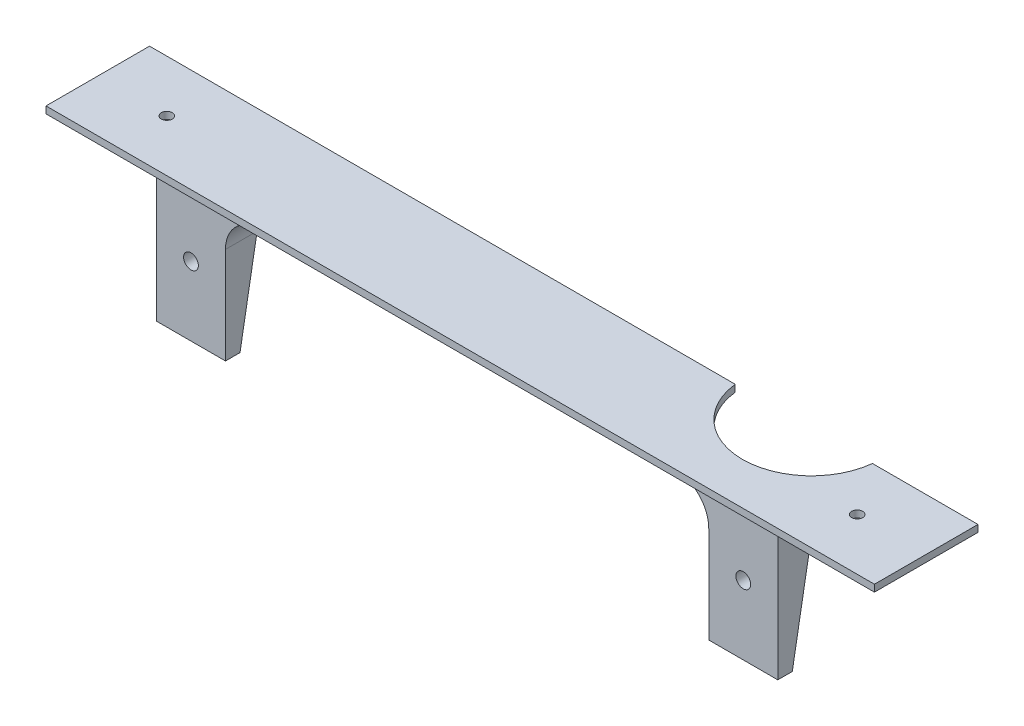
from build123d import *

# Parameters (mm, degrees)
ESQUISSE1_W             = 240
ESQUISSE1_H             = 2
BOSS_EXTRU_1_DEPTH      = 30
ESQUISSE1_3_W           = 180
ESQUISSE1_3_H           = 38
BOSS_EXTRU_2_DEPTH      = 1.2
ESQUISSE2_R             = 1.6
ENL_V_MAT_EXTRU_1_DEPTH = 131
ESQUISSE3_W             = 180
ESQUISSE3_H             = 38
BOSS_EXTRU_3_DEPTH      = 10
ESQUISSE4_W             = 180
ESQUISSE4_H             = 38
ENL_V_MAT_EXTRU_2_DEPTH = 2
ESQUISSE5_W             = 140
ESQUISSE5_H             = 38
ENL_V_MAT_EXTRU_3_DEPTH = 130.247823966
CONG_1_R                = 10
CHANFREIN1_START        = -21.049758641
CHANFREIN1_DEPTH        = 8.142458431
ESQUISSE6_R             = 2.15
ENL_V_MAT_EXTRU_4_DEPTH = 130.247823996
ESQUISSE9_R             = 20
ENL_V_MAT_EXTRU_6_DEPTH = 10


with BuildPart() as part:
    # Esquisse1 → Boss.-Extru.1 (new body)
    with BuildSketch(Plane.XY):
        Rectangle(ESQUISSE1_W, ESQUISSE1_H)
    extrude(amount=-BOSS_EXTRU_1_DEPTH)

    # Esquisse1<3> → Boss.-Extru.2 (add)
    with BuildSketch(Plane.XY):
        with Locations((0, -20)):
            Rectangle(ESQUISSE1_3_W, ESQUISSE1_3_H)
    extrude(amount=-BOSS_EXTRU_2_DEPTH)

    # Esquisse2 → Enlèv. mat.-Extru.1 (cut, through all)
    with BuildSketch(Plane(origin=(0, 1, 0), x_dir=(1, 0, 0), z_dir=(0, 1, 0))):
        with Locations(Location((-100, 15, 0), (0, 0, 270))):
            Circle(ESQUISSE2_R)
        with Locations(Location((100, 15, 0), (0, 0, 270))):
            Circle(ESQUISSE2_R)
    extrude(amount=-ENL_V_MAT_EXTRU_1_DEPTH, mode=Mode.SUBTRACT)

    # Esquisse3 → Boss.-Extru.3 (add)
    with BuildSketch(Plane(origin=(0, 0, -1.2), x_dir=(-1, 0, 0), z_dir=(0, 0, -1))):
        with Locations((0, -20)):
            Rectangle(ESQUISSE3_W, ESQUISSE3_H)
    extrude(amount=BOSS_EXTRU_3_DEPTH)

    # Esquisse4 → Enlèv. mat.-Extru.2 (cut)
    with BuildSketch(Plane.XY):
        with Locations((0, -20)):
            Rectangle(ESQUISSE4_W, ESQUISSE4_H)
    extrude(amount=-ENL_V_MAT_EXTRU_2_DEPTH, mode=Mode.SUBTRACT)

    # Esquisse5 → Enlèv. mat.-Extru.3 (cut, through all)
    with BuildSketch(Plane.XY.offset(-2)):
        with Locations((0, -20)):
            Rectangle(ESQUISSE5_W, ESQUISSE5_H)
    extrude(amount=-ENL_V_MAT_EXTRU_3_DEPTH, mode=Mode.SUBTRACT)

    # Congé1
    cong_1_edges = [part.edges().sort_by_distance(p)[0] for p in [
        (-80, -1, -11.2),
        (80, -1, -11.2),
        (70, -1, -6.6),
        (-70, -1, -6.6),
    ]]
    fillet(cong_1_edges, radius=CONG_1_R)

    # Chanfrein1: read off the stored shape, not the designer's step
    # Chanfrein1 outline → Chanfrein1 (cut)
    with BuildSketch(Plane(origin=(0, 0, 0), x_dir=(1, 0, 0), z_dir=(0, 0.17430886736371906, 0.9846910270528403)).offset(CHANFREIN1_START)):
        with BuildLine():
            Line((-70, -37.321496906), (-70, -8.886181431))
            add(Edge.make_bspline(
                [(-69.997176769, -8.644881308), (-70, -8.765514336), (-70, -8.886181431)],
                knots=[4.688626138, 4.688626138, 4.688626138, 4.71238898, 4.71238898, 4.71238898], degree=2, weights=[1, 0.999929417, 1]))
            Line((-69.997176769, -8.644881308), (-90, -8.644881308))
            Line((-90, -8.644881308), (-90, -37.321496906))
            Line((-90, -37.321496906), (-70, -37.321496906))
        make_face()
        with BuildLine():
            Line((90, -37.321496906), (90, -8.644881308))
            Line((90, -8.644881308), (69.997176769, -8.644881308))
            add(Edge.make_bspline(
                [(70, -8.886181431), (70, -8.765514336), (69.997176769, -8.644881308)],
                knots=[1.570796327, 1.570796327, 1.570796327, 1.59455917, 1.59455917, 1.59455917], degree=2, weights=[1, 0.999929417, 1]))
            Line((70, -8.886181431), (70, -37.321496906))
            Line((70, -37.321496906), (90, -37.321496906))
        make_face()
    extrude(amount=CHANFREIN1_DEPTH, mode=Mode.SUBTRACT)

    # Esquisse6 → Enlèv. mat.-Extru.4 (cut, through all)
    with BuildSketch(Plane.XY.offset(-2)):
        with Locations((80, -19)):
            Circle(ESQUISSE6_R)
        with Locations((-80, -19)):
            Circle(ESQUISSE6_R)
    extrude(amount=-ENL_V_MAT_EXTRU_4_DEPTH, mode=Mode.SUBTRACT)

    # Esquisse9 → Enlèv. mat.-Extru.6 (cut)
    with BuildSketch(Plane(origin=(0, 1, 0), x_dir=(1, 0, 0), z_dir=(0, 1, 0))):
        with Locations((69.55, 32.2)):
            Circle(ESQUISSE9_R)
    extrude(amount=-ENL_V_MAT_EXTRU_6_DEPTH, mode=Mode.SUBTRACT)


solid = part.part
